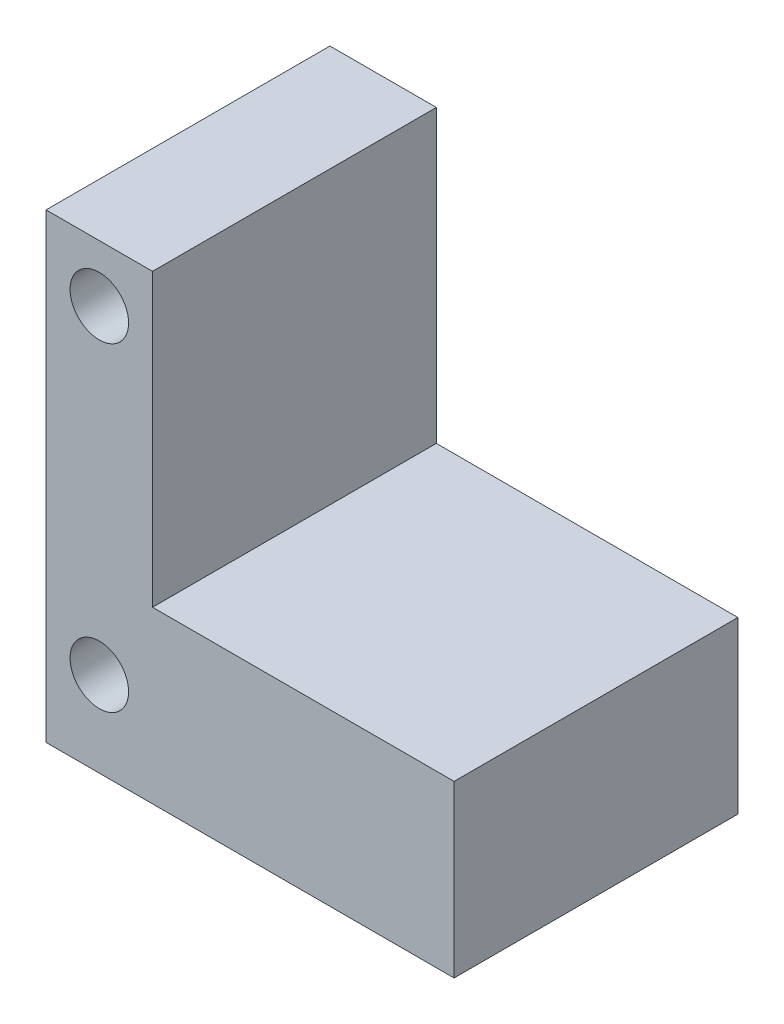
from build123d import *

# Parameters (mm, degrees)
SKETCH1_R           = 1.65
BOSS_EXTRUDE1_DEPTH = 16


with BuildPart() as part:
    # Sketch1 → Boss-Extrude1 (new body)
    with BuildSketch(Plane.XY.offset(44.914307383)):
        Polygon((-76, -26.196728555), (-99, -26.196728555), (-99, -0.196728555), (-93, -0.196728555), (-93, -16.596728555), (-76, -16.596728555), align=None)
        with Locations((-96.000000001, -21.39672823)):
            Circle(SKETCH1_R, mode=Mode.SUBTRACT)
        with Locations((-96.000000001, -3.39672823)):
            Circle(SKETCH1_R, mode=Mode.SUBTRACT)
    extrude(amount=-BOSS_EXTRUDE1_DEPTH)


solid = part.part
